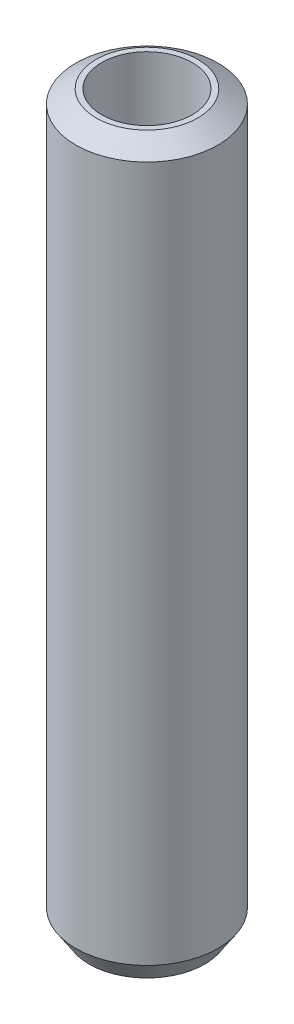
from build123d import *
from OCP.BRepFilletAPI import BRepFilletAPI_MakeChamfer

# Parameters (mm, degrees)
SKETCH1_R           = 25
BOSS_EXTRUDE1_DEPTH = 256.461505476
SKETCH2_R           = 15.929937286
CUT_EXTRUDE1_DEPTH  = 259.887048326
CHAMFER1_SIZE       = 4.684275889
CHAMFER1_SIZE2      = 7.135381225


with BuildPart() as part:
    # Sketch1 → Boss-Extrude1 (new body)
    with BuildSketch(Plane(origin=(0, 0, 0), x_dir=(1, 0, 0), z_dir=(0, 1, 0))):
        Circle(SKETCH1_R)
    extrude(amount=BOSS_EXTRUDE1_DEPTH)

    # Sketch2 → Cut-Extrude1 (cut, through all)
    with BuildSketch(Plane(origin=(0, 0, 0), x_dir=(1, 0, 0), z_dir=(0, 1, 0))):
        Circle(SKETCH2_R)
    extrude(amount=CUT_EXTRUDE1_DEPTH, mode=Mode.SUBTRACT)

    # Chamfer1: one chamfer whose edges measure the first distance from different faces: ONE call of the kernel's chamfer builder (chamfer() names one face for all edges)
    chamfer1_edges_1 = [part.edges().sort_by_distance(p)[0] for p in [
        (-25, 256.461505476, 0),
    ]]
    chamfer1_side_1 = [part.faces().sort_by_distance(p)[0] for p in [
        (-25, 128.230752738, 0),
    ]]
    chamfer1_edges_2 = [part.edges().sort_by_distance(p)[0] for p in [
        (-25, 0, 0),
    ]]
    chamfer1_side_2 = [part.faces().sort_by_distance(p)[0] for p in [
        (-24.292893219, 0, 0),
    ]]
    chamfer1 = BRepFilletAPI_MakeChamfer(part.part.solid().wrapped)
    for e in chamfer1_edges_1:
        chamfer1.Add(CHAMFER1_SIZE, CHAMFER1_SIZE2, e.wrapped, chamfer1_side_1[0].wrapped)  # the first distance lies on this face
    for e in chamfer1_edges_2:
        chamfer1.Add(CHAMFER1_SIZE, CHAMFER1_SIZE2, e.wrapped, chamfer1_side_2[0].wrapped)  # the first distance lies on this face
    add(Compound.cast(chamfer1.Shape()), mode=Mode.REPLACE)


solid = part.part
